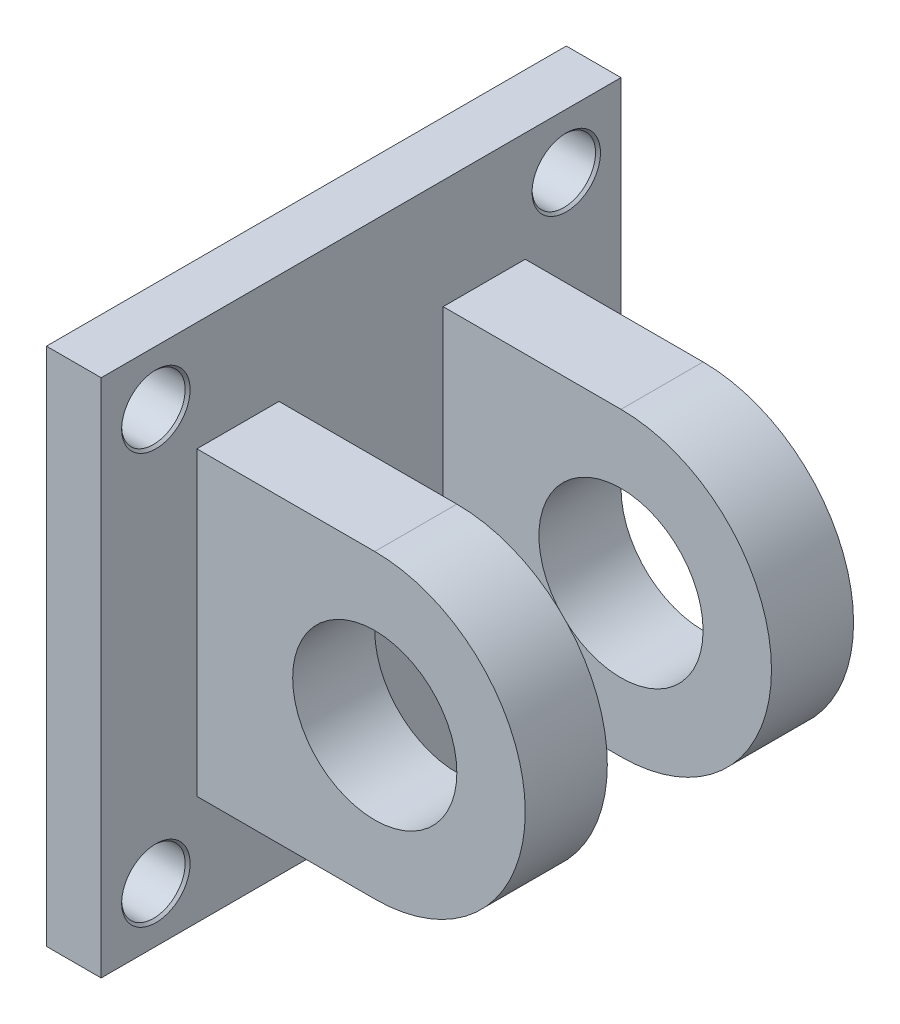
from build123d import *

# Parameters (mm, degrees)
SKETCH1_W                     = 241.3
SKETCH1_H                     = 241.3
BOSS_EXTRUDE1_DEPTH           = 25.4
BOSS_EXTRUDE2_DEPTH           = 38.1
BOSS_EXTRUDE3_START           = -38.1
BOSS_EXTRUDE3_DEPTH           = 38.1
F_1_1_8_CLEARANCE_HOLE1_D     = 29.45892
F_1_1_8_CLEARANCE_HOLE1_DEPTH = 177.8
F_1_1_8_CLEARANCE_HOLE2_D     = 29.45892
SKETCH8_W                     = 38.1
SKETCH8_H                     = 82.55
HOLE2_D                       = 76.2
HOLE2_DEPTH                   = 82.55
CHAMFER1_SIZE                 = 1.14554


with BuildPart() as part:
    # Sketch1 → Boss-Extrude1 (new body)
    with BuildSketch(Plane(origin=(25.4, 0, 0), x_dir=(0, 0, -1), z_dir=(1, 0, 0))):
        Rectangle(SKETCH1_W, SKETCH1_H)
    extrude(amount=-BOSS_EXTRUDE1_DEPTH)

    # Sketch2 → Boss-Extrude2 (add)
    with BuildSketch(Plane(origin=(0, 0, -76.2), x_dir=(-1, 0, 0), z_dir=(0, 0, -1))):
        with BuildLine():
            Line((-25.4, -69.85), (-25.4, 69.85))
            Line((-25.4, 69.85), (-107.95, 69.85))
            ThreePointArc((-107.95, 69.85), (-177.8, 0), (-107.95, -69.85))
            Line((-107.95, -69.85), (-25.4, -69.85))
        make_face()
    extrude(amount=-BOSS_EXTRUDE2_DEPTH)

    # Sketch3 → Boss-Extrude3 (add)
    with BuildSketch(Plane.XY.offset(76.2).offset(BOSS_EXTRUDE3_START)):
        with BuildLine():
            Line((25.4, 69.85), (25.4, -69.85))
            Line((25.4, -69.85), (107.95, -69.85))
            ThreePointArc((107.95, -69.85), (177.8, 0), (107.95, 69.85))
            Line((107.95, 69.85), (25.4, 69.85))
        make_face()
    extrude(amount=BOSS_EXTRUDE3_DEPTH)

    # 1-1/8 Clearance Hole1
    with Locations(Plane.ZY):
        with Locations((-95.25, -95.25), (95.25, -95.25)):
            Hole(F_1_1_8_CLEARANCE_HOLE1_D / 2, depth=F_1_1_8_CLEARANCE_HOLE1_DEPTH)

    # 1-1/8 Clearance Hole2 (through all)
    with Locations(Plane(origin=(25.4, 0, 0), x_dir=(0, 0, -1), z_dir=(1, 0, 0))):
        with Locations((-95.25, 95.25), (95.25, 95.25)):
            Hole(F_1_1_8_CLEARANCE_HOLE2_D / 2)

    # Sketch8 → Hole1 (revolve, cut)
    with BuildSketch(Plane(origin=(107.95, 0, 38.1), x_dir=(0, 1, 0), z_dir=(1, 0, 0))):
        with Locations((19.05, 41.275)):
            Rectangle(SKETCH8_W, SKETCH8_H)
    revolve(axis=Axis((107.95, 0, 148.1), (0, 0, -1)), mode=Mode.SUBTRACT)

    # Hole2
    with Locations(Plane.XY.offset(-38.1)):
        with Locations((107.95, 0)):
            Hole(HOLE2_D / 2, depth=HOLE2_DEPTH)

    # Chamfer1
    chamfer1_edges = [part.edges().sort_by_distance(p)[0] for p in [
        (25.4, -95.25, 109.97946),
        (25.4, -95.25, -80.52054),
        (0, -95.25, -80.52054),
        (0, 95.25, 80.52054),
        (0, -95.25, 109.97946),
        (0, 95.25, -109.97946),
        (25.4, 95.25, 80.52054),
        (25.4, 95.25, -109.97946),
    ]]
    chamfer(chamfer1_edges, length=CHAMFER1_SIZE)


solid = part.part
